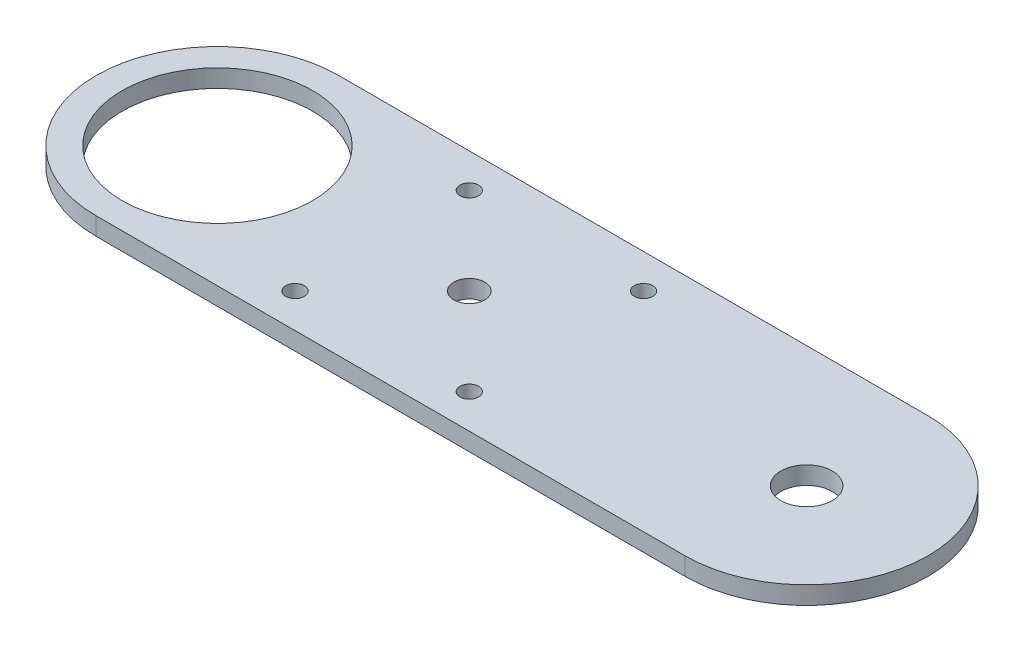
from build123d import *

# Parameters (mm, degrees)
SKETCH1_R           = 16.9545
SKETCH1_R_2         = 4.572
SKETCH1_R_3         = 2.75
SKETCH1_R_4         = 1.651
BOSS_EXTRUDE1_DEPTH = 3.175


with BuildPart() as part:
    # Sketch1 → Boss-Extrude1 (new body)
    with BuildSketch(Plane(origin=(0, 0, 0), x_dir=(1, 0, 0), z_dir=(0, 1, 0))):
        with BuildLine():
            Line((0, 21.59), (104.8004, 21.59))
            ThreePointArc((104.8004, 21.59), (126.3904, 0), (104.8004, -21.59))
            Line((104.8004, -21.59), (0, -21.59))
            ThreePointArc((0, -21.59), (-21.59, 0), (0, 21.59))
        make_face()
        Circle(SKETCH1_R, mode=Mode.SUBTRACT)
        with Locations((104.8004, 0)):
            Circle(SKETCH1_R_2, mode=Mode.SUBTRACT)
        with Locations((44.8004, 0)):
            Circle(SKETCH1_R_3, mode=Mode.SUBTRACT)
        with Locations((29.3004, -15.5)):
            Circle(SKETCH1_R_4, mode=Mode.SUBTRACT)
        with Locations((29.3004, 15.5)):
            Circle(SKETCH1_R_4, mode=Mode.SUBTRACT)
        with Locations((60.3004, 15.5)):
            Circle(SKETCH1_R_4, mode=Mode.SUBTRACT)
        with Locations((60.3004, -15.5)):
            Circle(SKETCH1_R_4, mode=Mode.SUBTRACT)
    extrude(amount=BOSS_EXTRUDE1_DEPTH)


solid = part.part
